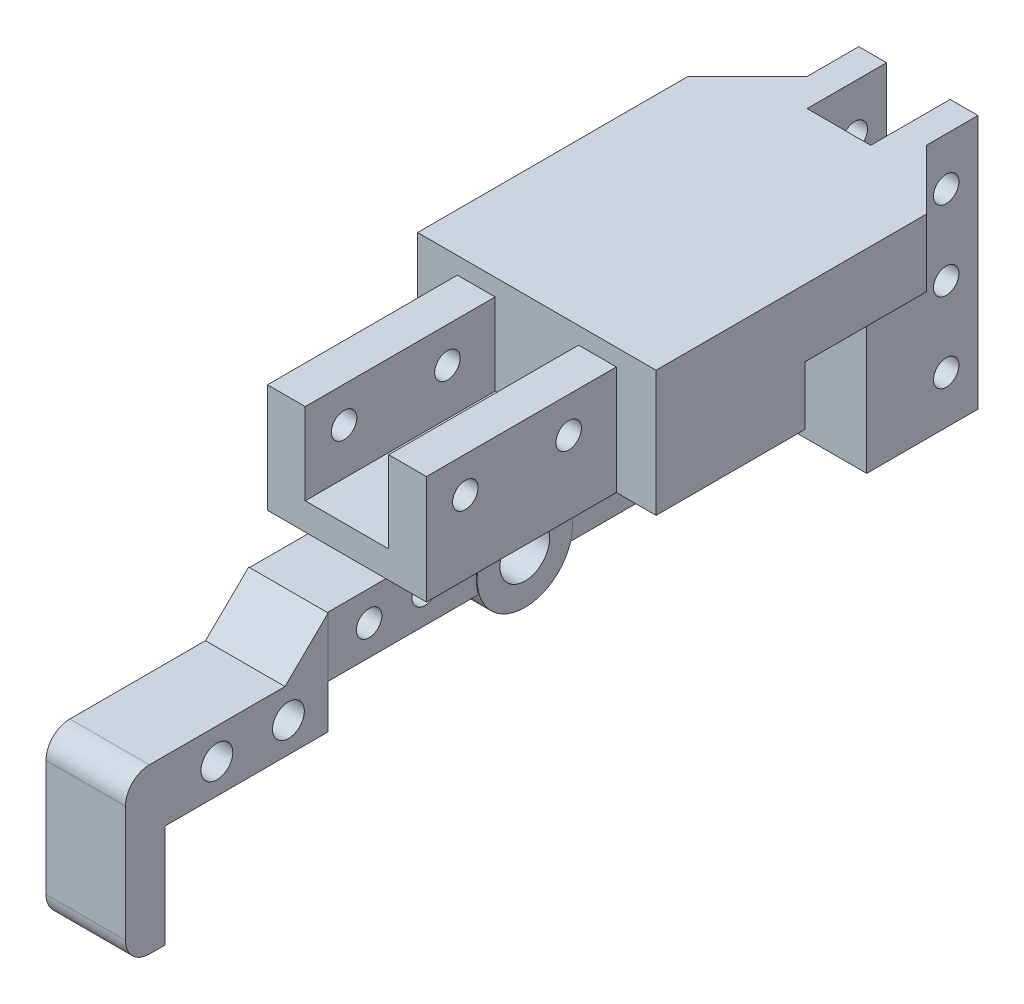
from build123d import *

# Parameters (mm, degrees)
SKETCH_2_W               = 50
SKETCH_2_H               = 7.55
SKETCH_2_R               = 1.6
EXTRUDE_1_DEPTH          = 4.9
SKETCH_3_W               = 23.885574904
SKETCH_3_H               = 13.680093874
SKETCH_3_R               = 1.6
EXTRUDE_2_DEPTH          = 10
SKETCH_4_W               = 10.5
SKETCH_4_H               = 10.264550668
CUT_EXTRUDE_1_DEPTH      = 48.143107127
SKETCH_6_W               = 14
SKETCH_6_H               = 32
SKETCH_6_R               = 1.6
EXTRUDE_4_DEPTH          = 7.5
SKETCH_7_W               = 8
SKETCH_7_H               = 32
CUT_EXTRUDE_2_DEPTH      = 10
EXTRUDE_5_DEPTH          = 15
CHAMFER_1_SIZE           = 7.5
SKETCH_10_R              = 2
EXTRUDE_6_DEPTH          = 5
FILLET_1_R               = 3
SKETCH_11_R              = 6
SKETCH_11_R_2            = 3.125
EXTRUDE_7_DEPTH          = 5
CUT_EXTRUDE_3_DEPTH      = 79.685454984
CUT_EXTRUDE_3_DEPTH_BACK = 79.685454984
SKETCH_12_R              = 3.125


with BuildPart() as part:
    # 草图2 → 凸台-拉伸1 (new, symmetric)
    with BuildSketch(Plane(origin=(0, 0, 0), x_dir=(0, 0, -1), z_dir=(1, 0, 0))):
        with Locations((19.75, 0)):
            Rectangle(SKETCH_2_W, SKETCH_2_H)
        Circle(SKETCH_2_R, mode=Mode.SUBTRACT)
        with Locations((7, 0)):
            Circle(SKETCH_2_R, mode=Mode.SUBTRACT)
        with Locations((32.5, 0)):
            Circle(SKETCH_2_R, mode=Mode.SUBTRACT)
        with Locations((39.5, 0)):
            Circle(SKETCH_2_R, mode=Mode.SUBTRACT)
    extrude(amount=EXTRUDE_1_DEPTH, both=True)

    # 草图3 → 凸台-拉伸2 (add, symmetric)
    with BuildSketch(Plane(origin=(0, 0, 0), x_dir=(0, 0, -1), z_dir=(1, 0, 0))):
        with Locations((14.057212548, 10.615046937)):
            Rectangle(SKETCH_3_W, SKETCH_3_H)
        with Locations((7, 13)):
            Circle(SKETCH_3_R, mode=Mode.SUBTRACT)
        with Locations((20, 13)):
            Circle(SKETCH_3_R, mode=Mode.SUBTRACT)
    extrude(amount=EXTRUDE_2_DEPTH, both=True)

    # 草图4 → 切除-拉伸1 (cut, through all)
    with BuildSketch(Plane.XY.offset(-2.114425096)):
        with Locations((0, 12.32281854)):
            Rectangle(SKETCH_4_W, SKETCH_4_H)
    extrude(amount=-CUT_EXTRUDE_1_DEPTH, mode=Mode.SUBTRACT)



with BuildPart() as body_2:
    # 草图6 → 凸台-拉伸4 (new, symmetric)
    with BuildSketch(Plane(origin=(0, 0, 0), x_dir=(0, 0, -1), z_dir=(1, 0, 0))):
        with Locations((67, 3.6)):
            Rectangle(SKETCH_6_W, SKETCH_6_H)
        with Locations((70, 3.6)):
            Circle(SKETCH_6_R, mode=Mode.SUBTRACT)
        with Locations((70, 13.6)):
            Circle(SKETCH_6_R, mode=Mode.SUBTRACT)
        with Locations((70, -6.4)):
            Circle(SKETCH_6_R, mode=Mode.SUBTRACT)
    extrude(amount=EXTRUDE_4_DEPTH, both=True)

    # 草图7 → 切除-拉伸2 (cut)
    with BuildSketch(Plane.XY.offset(-74)):
        with Locations((0, 3.6)):
            Rectangle(SKETCH_7_W, SKETCH_7_H)
    extrude(amount=CUT_EXTRUDE_2_DEPTH, mode=Mode.SUBTRACT)


with BuildPart() as part_1:
    add(part.part)

    add(body_2.part)  # 凸台-拉伸5 merges body 2
    # 草图8 → 凸台-拉伸5 (add, symmetric)
    with BuildSketch(Plane(origin=(0, 0, 0), x_dir=(0, 0, -1), z_dir=(1, 0, 0))):
        Polygon((60, 19.6), (26, 19.6), (26, 11.139938787), (26, 3.775), (44.75, 3.775), (44.75, 11.139938787), (60, 11.139938787), align=None)
    extrude(amount=EXTRUDE_5_DEPTH, both=True)

    # 倒角1
    chamfer_1_edges = [part_1.edges().sort_by_distance(p)[0] for p in [
        (-7.5, 15.369969393, -60),
        (7.5, 15.369969393, -60),
    ]]
    chamfer(chamfer_1_edges, length=CHAMFER_1_SIZE - 0.0001)  # a hair under: the kernel refuses the full size

    # 草图10 → 凸台-拉伸6 (add, symmetric)
    with BuildSketch(Plane(origin=(0, 0, 0), x_dir=(0, 0, -1), z_dir=(1, 0, 0))):
        Polygon((-5.25, 3.775), (-5.25, -9.176683543), (-25.75, -9.176683543), (-25.75, -22.144995508), (-30.75, -22.144995508), (-30.75, -1.524124881), (-10.688710914, -1.524124881), align=None)
        with Locations((-10.25, -5.401683543)):
            Circle(SKETCH_10_R, mode=Mode.SUBTRACT)
        with Locations((-19.25, -5.401683543)):
            Circle(SKETCH_10_R, mode=Mode.SUBTRACT)
    extrude(amount=EXTRUDE_6_DEPTH, both=True)

    # 圆角1
    fillet_1_edges = [part_1.edges().sort_by_distance(p)[0] for p in [
        (0, -1.524124881, 30.75),
        (0, -22.144995508, 30.75),
    ]]
    fillet(fillet_1_edges, radius=FILLET_1_R)

    # 草图11 → 凸台-拉伸7 (add, symmetric)
    with BuildSketch(Plane(origin=(0, 0, 0), x_dir=(0, 0, -1), z_dir=(1, 0, 0))):
        with Locations((19.487465682, -2)):
            Circle(SKETCH_11_R)
        with Locations((19.487465682, -2)):
            Circle(SKETCH_11_R_2, mode=Mode.SUBTRACT)
    extrude(amount=EXTRUDE_7_DEPTH, both=True)

    # 草图12 → 切除-拉伸3 (cut, two sides: drawn at the far end of the back side and taken through both)
    with BuildSketch(Plane(origin=(0, 0, 0), x_dir=(0, 0, -1), z_dir=(1, 0, 0)).offset(-CUT_EXTRUDE_3_DEPTH_BACK)):
        with Locations((19.487465682, -2)):
            Circle(SKETCH_12_R)
    extrude(amount=CUT_EXTRUDE_3_DEPTH + CUT_EXTRUDE_3_DEPTH_BACK, mode=Mode.SUBTRACT)


solid = part_1.part
